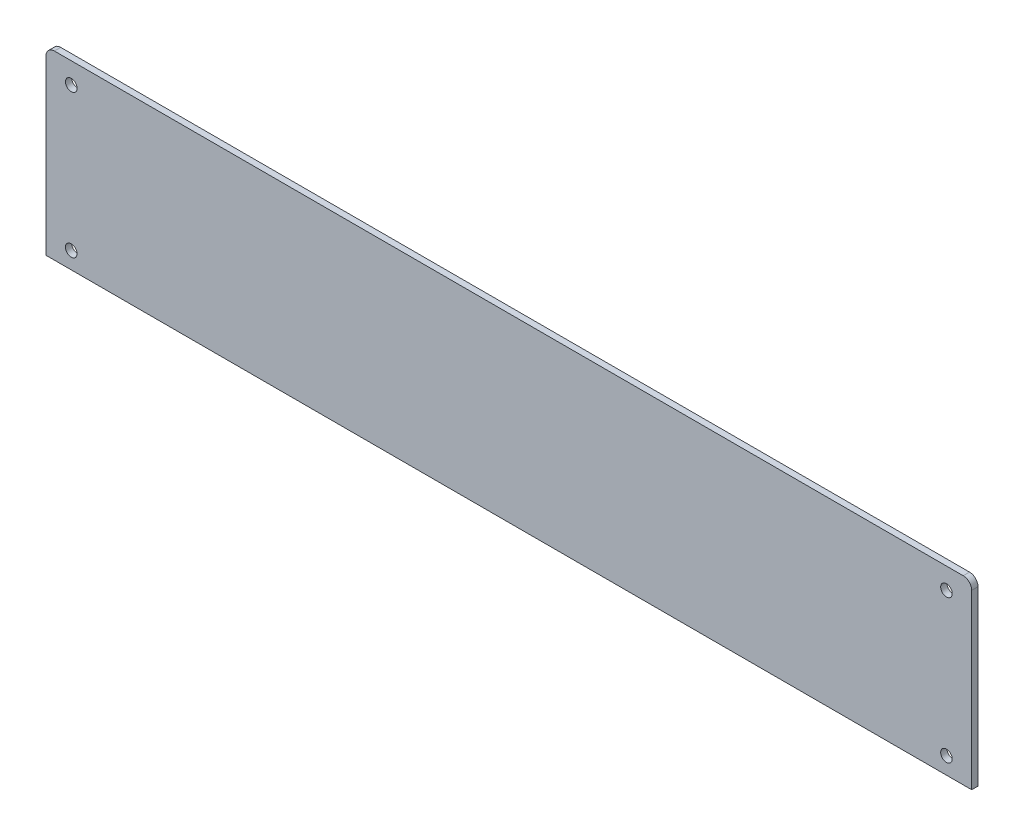
from build123d import *

# Parameters (mm, degrees)
SKETCH_1_W          = 440
SKETCH_1_H          = 86.1
EXTRUDE_1_DEPTH     = 3
SKETCH_6_R          = 2.75
CUT_EXTRUDE_1_DEPTH = 449.355004433
FILLET_1_R          = 4


with BuildPart() as part:
    # Эскиз1 → Бобышка-Вытянуть1 (new body)
    with BuildSketch(Plane.XY):
        with Locations((220, 43.05)):
            Rectangle(SKETCH_1_W, SKETCH_1_H)
    extrude(amount=EXTRUDE_1_DEPTH)

    # Эскиз6 → Вырез-Вытянуть1 (cut, through all)
    with BuildSketch(Plane(origin=(0, 0, 0), x_dir=(-1, 0, 0), z_dir=(0, 0, -1))):
        with Locations((-428, 76.1)):
            Circle(SKETCH_6_R)
        with Locations((-428, 8)):
            Circle(SKETCH_6_R)
        with Locations((-12, 8)):
            Circle(SKETCH_6_R)
        with Locations((-12, 76.1)):
            Circle(SKETCH_6_R)
    extrude(amount=-CUT_EXTRUDE_1_DEPTH, mode=Mode.SUBTRACT)

    # Скругление1
    fillet_1_edges = [part.edges().sort_by_distance(p)[0] for p in [
        (0, 86.1, 1.5),
        (440, 86.1, 1.5),
    ]]
    fillet(fillet_1_edges, radius=FILLET_1_R)


solid = part.part
